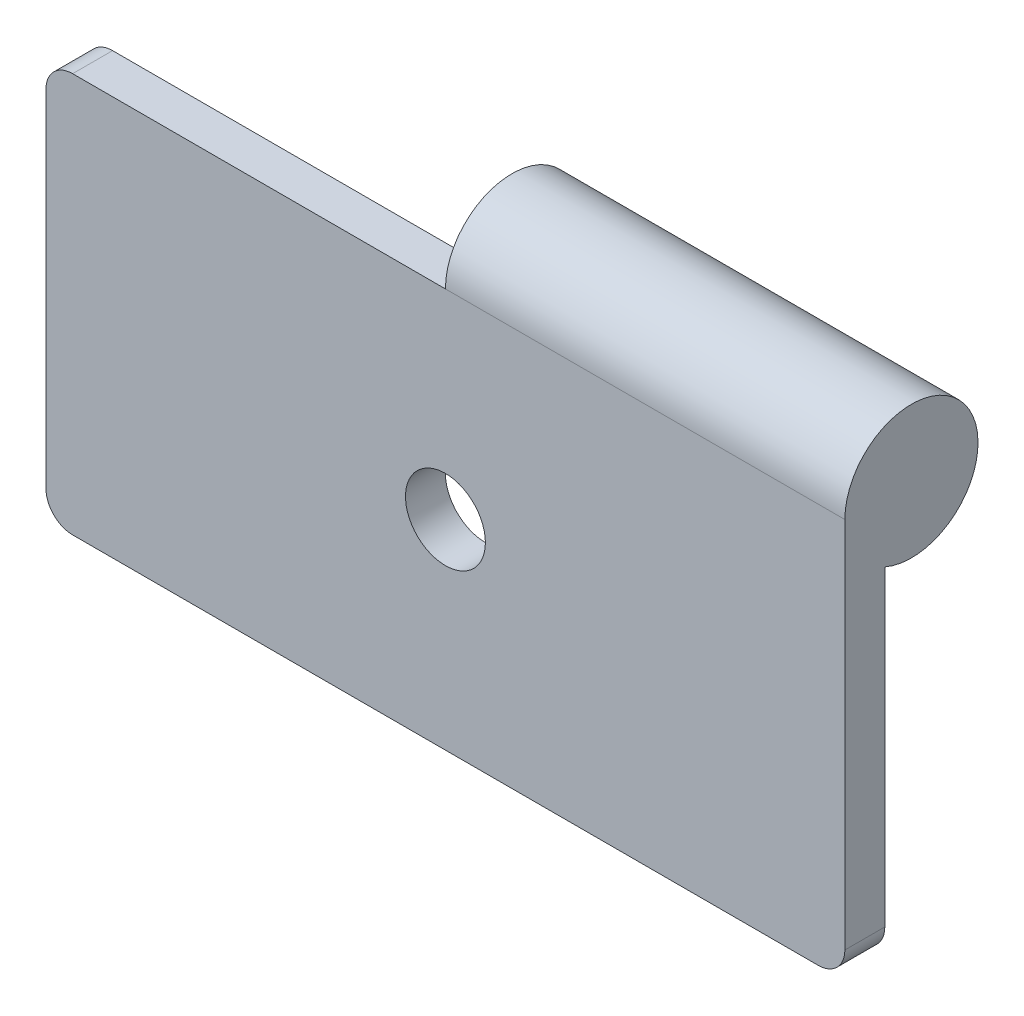
from build123d import *

# Parameters (mm, degrees)
SKETCH_1_W             = 30
SKETCH_1_H             = 15
SM_BASE_FLANGE_1_DEPTH = 1.5
SKETCH_6_R             = 2.5
EXTRUDE_1_DEPTH        = 15
SKETCH_7_R             = 1.5
CUT_EXTRUDE_1_DEPTH    = 15
FILLET_1_R             = 1


# Sheet-metal steps are written as plain solids
with BuildPart() as part:
    # Sketch 1 → 基体-法兰1 (new body)
    with BuildSketch(Plane.XY):
        Rectangle(SKETCH_1_W, SKETCH_1_H)
    extrude(amount=-SM_BASE_FLANGE_1_DEPTH)

    # 草图6 → 凸台-拉伸1 (add)
    with BuildSketch(Plane(origin=(15, 0, 0), x_dir=(0, 0, -1), z_dir=(1, 0, 0))):
        with Locations((2.5, 7.5)):
            Circle(SKETCH_6_R)
    extrude(amount=-EXTRUDE_1_DEPTH)

    # 草图7 → 切除-拉伸1 (cut)
    with BuildSketch(Plane.XY):
        Circle(SKETCH_7_R)
    extrude(amount=-CUT_EXTRUDE_1_DEPTH, mode=Mode.SUBTRACT)

    # 圆角1
    fillet_1_edges = [part.edges().sort_by_distance(p)[0] for p in [
        (15, -7.5, -0.75),
        (-15, -7.5, -0.75),
        (-15, 7.5, -0.75),
    ]]
    fillet(fillet_1_edges, radius=FILLET_1_R)


solid = part.part
